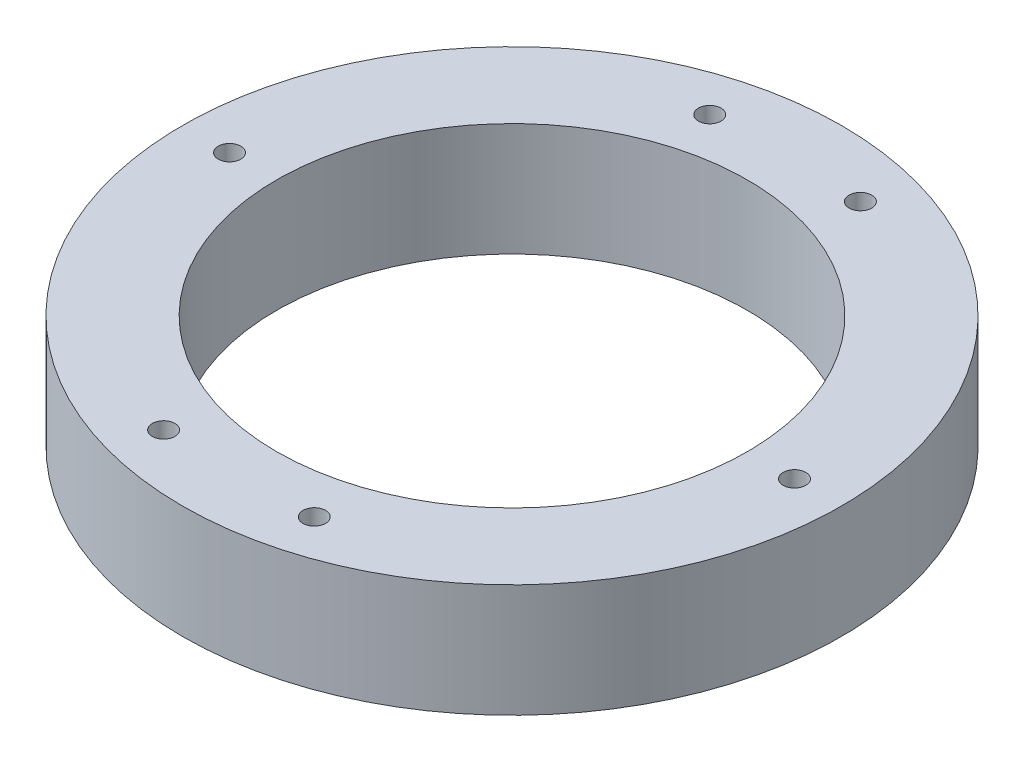
from build123d import *

# Parameters (mm, degrees)
SKETCH1_R           = 17.5
SKETCH1_R_2         = 0.6
SKETCH1_R_3         = 12.5
BOSS_EXTRUDE1_DEPTH = 6


with BuildPart() as part:
    # Sketch1 → Boss-Extrude1 (new body)
    with BuildSketch(Plane(origin=(0, 0, 0), x_dir=(1, 0, 0), z_dir=(0, 1, 0))):
        Circle(SKETCH1_R)
        with Locations((-4, 14.5)):
            Circle(SKETCH1_R_2, mode=Mode.SUBTRACT)
        with Locations((-4, -14.5)):
            Circle(SKETCH1_R_2, mode=Mode.SUBTRACT)
        with Locations((15, 0)):
            Circle(SKETCH1_R_2, mode=Mode.SUBTRACT)
        with Locations((-15, 0)):
            Circle(SKETCH1_R_2, mode=Mode.SUBTRACT)
        with Locations((4, 14.5)):
            Circle(SKETCH1_R_2, mode=Mode.SUBTRACT)
        with Locations((4, -14.5)):
            Circle(SKETCH1_R_2, mode=Mode.SUBTRACT)
        Circle(SKETCH1_R_3, mode=Mode.SUBTRACT)
    extrude(amount=BOSS_EXTRUDE1_DEPTH)


solid = part.part
